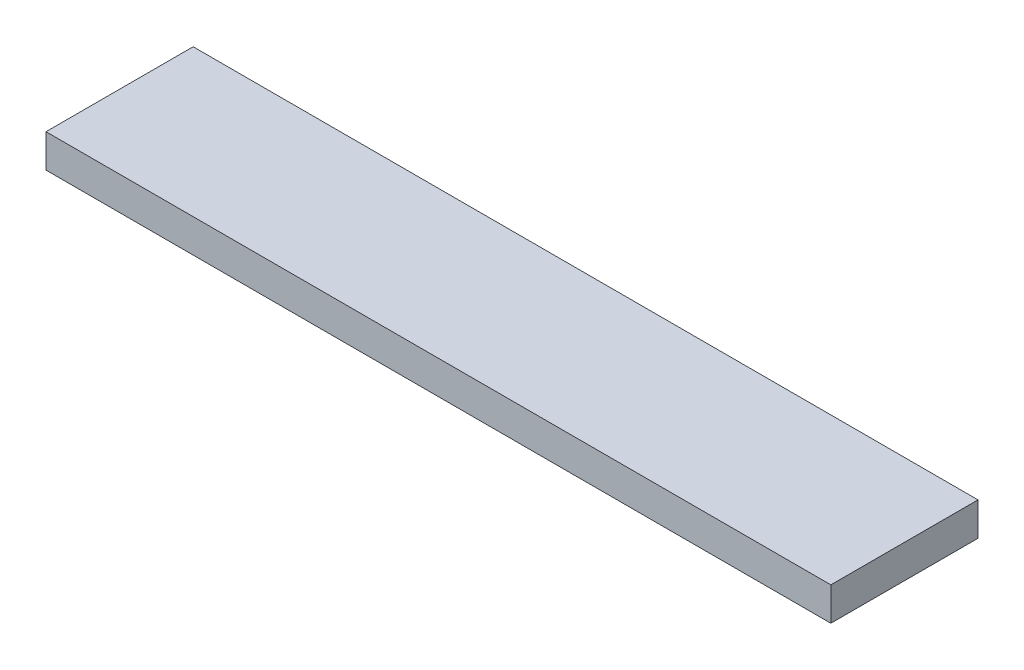
from build123d import *

# Parameters (mm, degrees)
SKETCH_1_W      = 224
SKETCH_1_H      = 42
EXTRUDE_1_DEPTH = 9.5


with BuildPart() as part:
    # 草图1 → 凸台-拉伸1 (new body)
    with BuildSketch(Plane(origin=(0, 0, 0), x_dir=(1, 0, 0), z_dir=(0, 1, 0))):
        with Locations((112, 21)):
            Rectangle(SKETCH_1_W, SKETCH_1_H)
    extrude(amount=EXTRUDE_1_DEPTH)


solid = part.part
